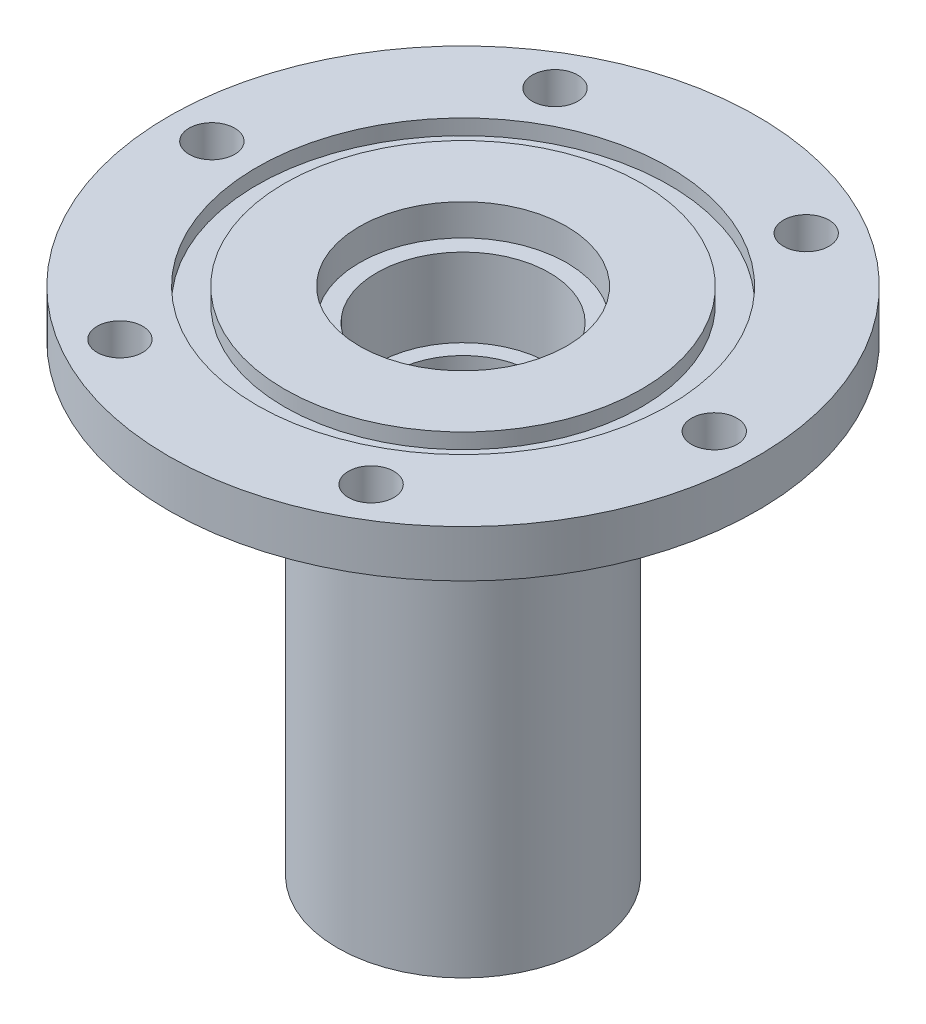
from build123d import *

# Parameters (mm, degrees)
M5_CLEARANCE_HOLE1_D = 5.8


with BuildPart() as part:
    # Sketch1 → Revolve1 (revolve)
    with BuildSketch(Plane.XY):
        Polygon((37.5, 0), (26.2636, 0), (26.2636, -1.9558), (22.733, -1.9558), (22.733, 0), (13.2, 0), (13.2, -4), (11, -4), (11, -14), (9, -14), (9, -17), (11, -17), (11, -30.5), (12.5, -30.5), (12.5, -65), (16, -65), (16, -6), (37.5, -6), align=None)
    revolve(axis=Axis((0, 0, 0), (0, -1, 0)))

    # M5 Clearance Hole1 (through all)
    with Locations(Plane(origin=(0, 0, 0), x_dir=(1, 0, 0), z_dir=(0, 1, 0))):
        with Locations((16, 27.712812921), (32, 0), (16, -27.712812921), (-16, -27.712812921), (-32, 0), (-16, 27.712812921)):
            Hole(M5_CLEARANCE_HOLE1_D / 2)


solid = part.part
